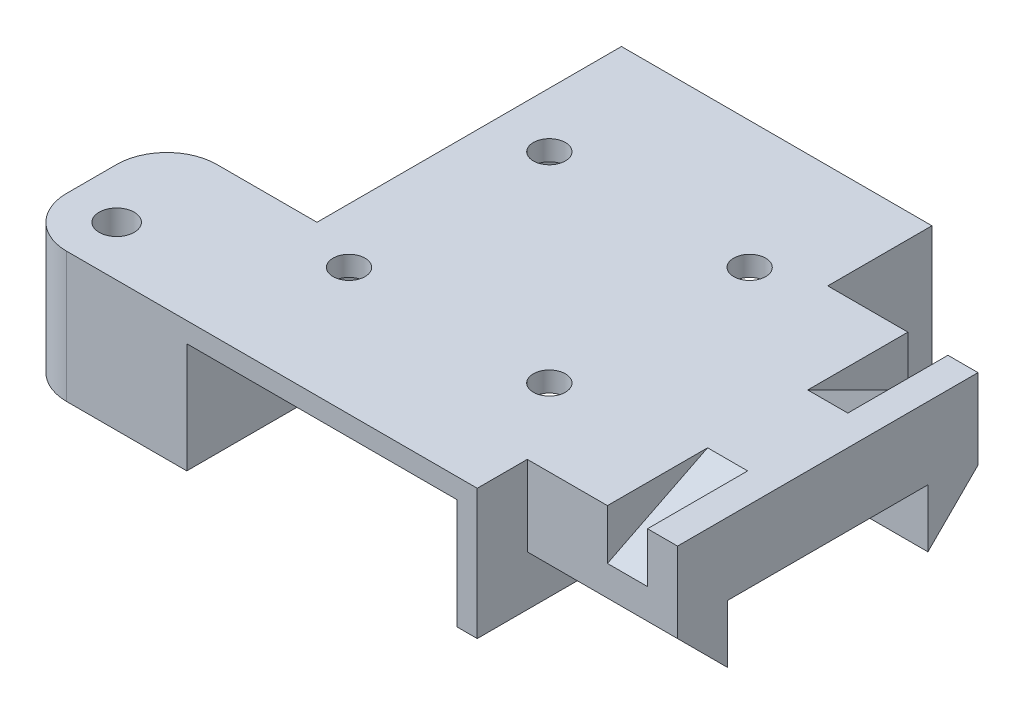
from build123d import *

# Parameters (mm, degrees)
SKETCH1_W           = 31
SKETCH1_H           = 45.4
BOSS_EXTRUDE1_DEPTH = 13
SKETCH2_W           = 27
SKETCH2_H           = 11
CUT_EXTRUDE1_DEPTH  = 57.490353159
SKETCH3_R           = 1.6
CUT_EXTRUDE2_DEPTH  = 10
SKETCH4_W           = 15
SKETCH4_H           = 13
BOSS_EXTRUDE2_DEPTH = 15
SKETCH5_R           = 1.75
CUT_EXTRUDE3_DEPTH  = 20
FILLET1_R           = 5
BOSS_EXTRUDE3_DEPTH = 15
CHAMFER1_SIZE       = 5
CUT_EXTRUDE4_DEPTH  = 4


with BuildPart() as part:
    # Sketch1 → Boss-Extrude1 (new body)
    with BuildSketch(Plane(origin=(0, 0, 0), x_dir=(1, 0, 0), z_dir=(0, 1, 0))):
        with Locations((15.5, 22.7)):
            Rectangle(SKETCH1_W, SKETCH1_H)
    extrude(amount=BOSS_EXTRUDE1_DEPTH)

    # Sketch2 → Cut-Extrude1 (cut, through all)
    with BuildSketch(Plane.XY):
        with Locations((15.5, 5.5)):
            Rectangle(SKETCH2_W, SKETCH2_H)
    extrude(amount=-CUT_EXTRUDE1_DEPTH, mode=Mode.SUBTRACT)

    # Sketch3 → Cut-Extrude2 (cut)
    with BuildSketch(Plane(origin=(0, 13, 0), x_dir=(1, 0, 0), z_dir=(0, 1, 0))):
        with Locations(Location((5.5, 32.7, 0), (0, 0, 270))):
            Circle(SKETCH3_R)
        with Locations(Location((25.5, 32.7, 0), (0, 0, 270))):
            Circle(SKETCH3_R)
        with Locations(Location((25.5, 12.7, 0), (0, 0, 270))):
            Circle(SKETCH3_R)
        with Locations(Location((5.5, 12.7, 0), (0, 0, 270))):
            Circle(SKETCH3_R)
    extrude(amount=-CUT_EXTRUDE2_DEPTH, mode=Mode.SUBTRACT)

    # Sketch4 → Boss-Extrude2 (add)
    with BuildSketch(Plane.ZY):
        with Locations((-7.5, 6.5)):
            Rectangle(SKETCH4_W, SKETCH4_H)
    extrude(amount=BOSS_EXTRUDE2_DEPTH)

    # Sketch5 → Cut-Extrude3 (cut)
    with BuildSketch(Plane(origin=(0, 13, 0), x_dir=(1, 0, 0), z_dir=(0, 1, 0))):
        with Locations(Location((-10, 5, 0), (0, 0, 270))):
            Circle(SKETCH5_R)
    extrude(amount=-CUT_EXTRUDE3_DEPTH, mode=Mode.SUBTRACT)

    # Fillet1
    fillet1_edges = [part.edges().sort_by_distance(p)[0] for p in [
        (-15, 6.5, -15),
        (-15, 6.5, 0),
    ]]
    fillet(fillet1_edges, radius=FILLET1_R)

    # Sketch6 → Boss-Extrude3 (add)
    with BuildSketch(Plane(origin=(31, 0, 0), x_dir=(0, 0, -1), z_dir=(1, 0, 0))):
        Polygon((5, 0), (10, 0), (10, 5.8), (30, 5.8), (30, 0), (35, 0), (35, 13), (5, 13), align=None)
    extrude(amount=BOSS_EXTRUDE3_DEPTH)

    # Chamfer1
    chamfer1_edges = [part.edges().sort_by_distance(p)[0] for p in [
        (38.5, 0, -5),
        (38.5, 0, -35),
    ]]
    chamfer(chamfer1_edges, length=CHAMFER1_SIZE - 0.0001)  # a hair under: the kernel refuses the full size

    # Sketch7 → Cut-Extrude4 (cut)
    with BuildSketch(Plane(origin=(43, 0, 0), x_dir=(0, 0, -1), z_dir=(1, 0, 0))):
        Polygon((5, 8), (15, 13), (5, 13), align=None)
        Polygon((35, 8), (25, 13), (35, 13), align=None)
    extrude(amount=-CUT_EXTRUDE4_DEPTH, mode=Mode.SUBTRACT)


solid = part.part
